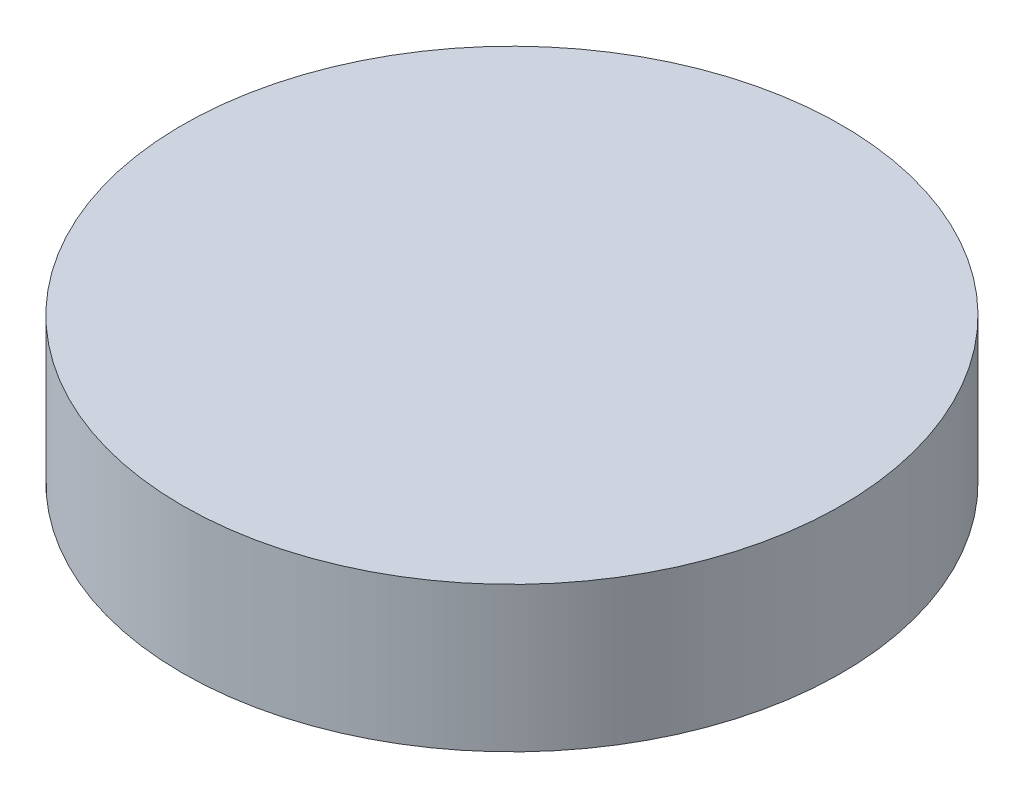
from build123d import *

# Parameters (mm, degrees)
SKETCH1_R           = 72.7
BOSS_EXTRUDE1_DEPTH = 32


with BuildPart() as part:
    # Sketch1 → Boss-Extrude1 (new body)
    with BuildSketch(Plane(origin=(0, 0, 0), x_dir=(1, 0, 0), z_dir=(0, 1, 0))):
        Circle(SKETCH1_R)
    extrude(amount=BOSS_EXTRUDE1_DEPTH)


solid = part.part
